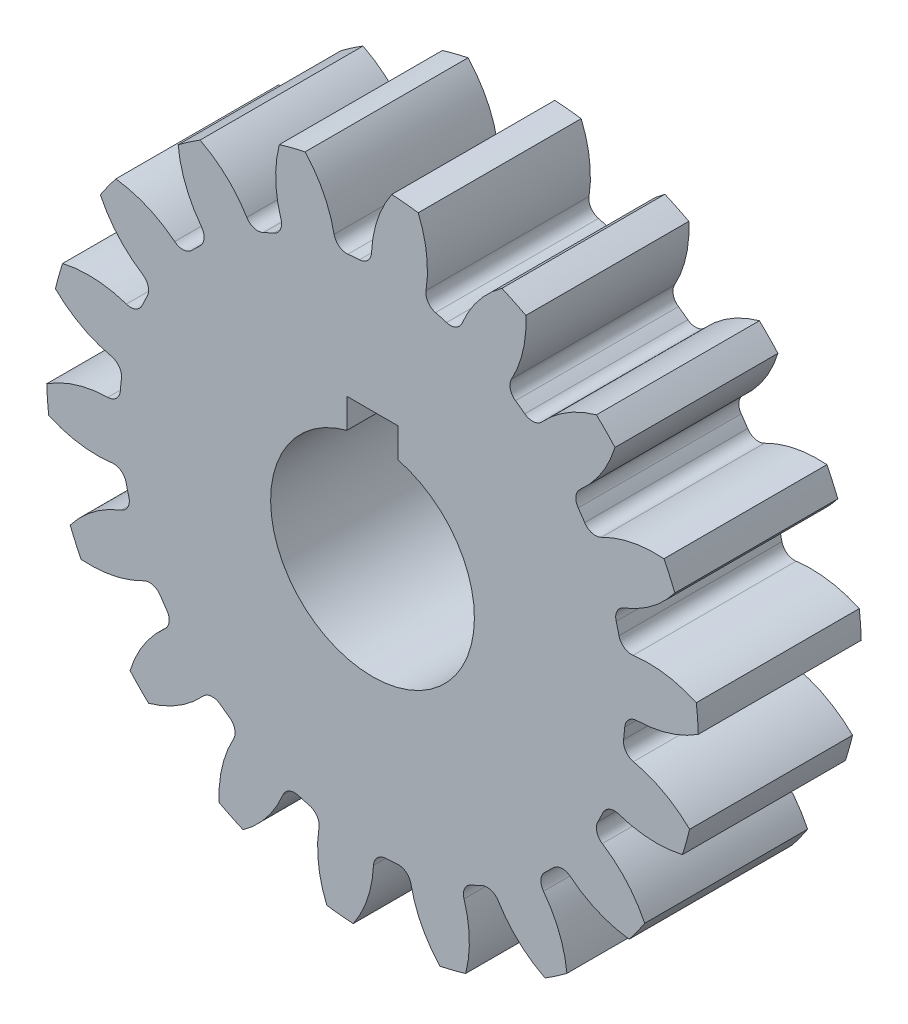
from build123d import *

# Parameters (mm, degrees)
SKETCH3_R         = 12.7
GEARBODY_DEPTH    = 6.35
TOOTHCUT_DEPTH    = 20.05
CIRPATTERN1_COUNT = 18
BORE_DEPTH        = 12700


with BuildPart() as part:
    # Sketch3 → gearBody (new body)
    with BuildSketch(Plane.XY):
        Circle(SKETCH3_R)
    extrude(amount=GEARBODY_DEPTH)

    # Sketch2 → toothCut (cut, through all)
    with BuildSketch(Plane.XY):
        with BuildLine():
            ThreePointArc((9.781229257, -1.205205904), (9.806057787, -0.982953571), (9.825836884, -0.760195085))
            ThreePointArc((9.825836884, -0.760195085), (9.980803767, -0.435792976), (10.31355819, -0.299682883))
            ThreePointArc((10.31355819, -0.299682883), (12.38209996, 0.246018063), (13.970369973, 1.679214819))
            ThreePointArc((13.970369973, 1.679214819), (14.000763839, -1.403428484), (13.359117821, -4.418706897))
            ThreePointArc((13.359117821, -4.418706897), (12.0869153, -2.698778026), (10.167842346, -1.753360882))
            ThreePointArc((10.167842346, -1.753360882), (9.868724138, -1.553912241), (9.781229257, -1.205205904))
        make_face()
    toothcut = extrude(amount=TOOTHCUT_DEPTH, mode=Mode.SUBTRACT)

    # CirPattern1: toothCut ×18 about axis
    cirpattern1_axis = Axis((0, 0, 6.35), (0, 0, -1))
    for i in range(1, CIRPATTERN1_COUNT):
        add(toothcut.rotate(cirpattern1_axis, i * 360 / CIRPATTERN1_COUNT), mode=Mode.SUBTRACT)

    # boreDia → bore (cut, symmetric)
    with BuildSketch(Plane.XY):
        with BuildLine():
            Line((-1, 3.842012337), (-1, 4.992632337))
            Line((-1, 4.992632337), (1, 4.992632337))
            Line((1, 4.992632337), (1, 3.842012337))
            ThreePointArc((1, 3.842012337), (0, -3.97002), (-1, 3.842012337))
        make_face()
    extrude(amount=BORE_DEPTH, both=True, mode=Mode.SUBTRACT)


solid = part.part
